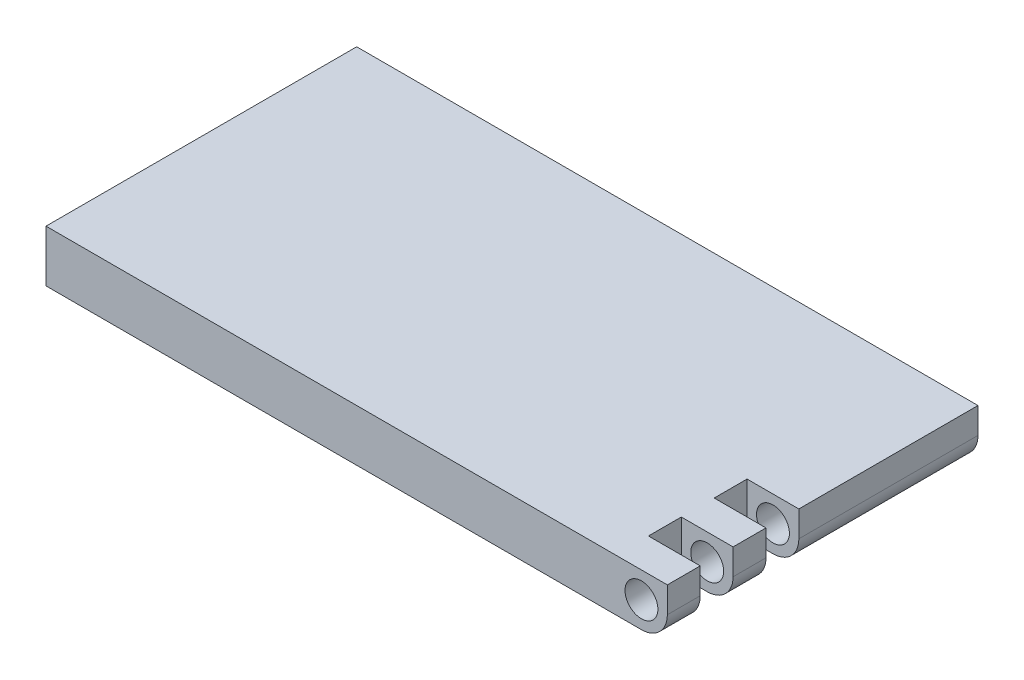
from build123d import *

# Parameters (mm, degrees)
SKETCH1_W           = 120
SKETCH1_H           = 60
BOSS_EXTRUDE1_DEPTH = 10
SKETCH2_R           = 3.175
CUT_EXTRUDE1_DEPTH  = 86.440037453
FILLET2_R           = 5
SKETCH4_W           = 10
SKETCH4_H           = 6.35
CUT_EXTRUDE2_DEPTH  = 68.823299831
LPATTERN1_COUNT     = 2
LPATTERN1_PITCH     = 12.7


with BuildPart() as part:
    # Sketch1 → Boss-Extrude1 (new body)
    with BuildSketch(Plane(origin=(0, 0, 0), x_dir=(1, 0, 0), z_dir=(0, 1, 0))):
        Rectangle(SKETCH1_W, SKETCH1_H)
    extrude(amount=BOSS_EXTRUDE1_DEPTH)

    # Sketch2 → Cut-Extrude1 (cut, through all)
    with BuildSketch(Plane.XY.offset(30)):
        with Locations((55, 5)):
            Circle(SKETCH2_R)
    extrude(amount=-CUT_EXTRUDE1_DEPTH, mode=Mode.SUBTRACT)

    # Fillet2
    fillet2_edges = [part.edges().sort_by_distance(p)[0] for p in [
        (60, 0, 0),
    ]]
    fillet(fillet2_edges, radius=FILLET2_R)

    # Sketch4 → Cut-Extrude2 (cut, through all)
    with BuildSketch(Plane(origin=(0, 10, 0), x_dir=(1, 0, 0), z_dir=(0, 1, 0))):
        with Locations((55, -20.475)):
            Rectangle(SKETCH4_W, SKETCH4_H)
    cut_extrude2 = extrude(amount=-CUT_EXTRUDE2_DEPTH, mode=Mode.SUBTRACT)

    # LPattern1: Cut-Extrude2 ×2
    with Locations(*[(0, 0, -i * LPATTERN1_PITCH) for i in range(1, LPATTERN1_COUNT)]):
        add(cut_extrude2, mode=Mode.SUBTRACT)


solid = part.part
